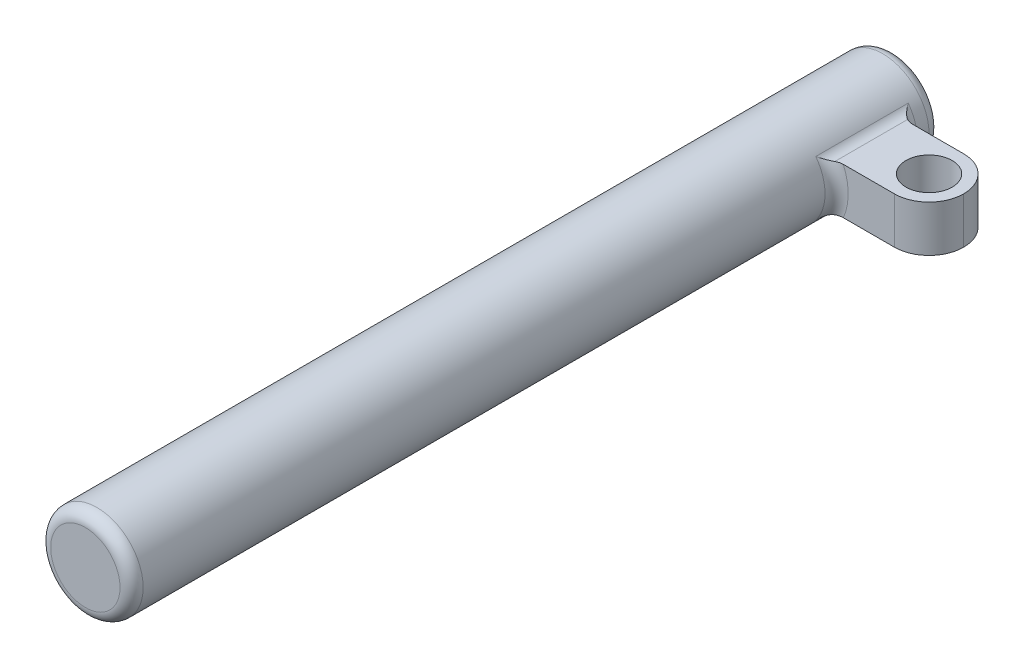
from build123d import *

# Parameters (mm, degrees)
SKETCH1_R           = 10.16
BOSS_EXTRUDE1_DEPTH = 88.9
FILLET1_R           = 2.54
SKETCH3_W           = 15.24
SKETCH3_H           = 10.16
BOSS_EXTRUDE2_DEPTH = 30.48
FILLET2_R           = 7.62
CUT_EXTRUDE1_REACH  = 97.208
SKETCH4_R           = 5.08
FILLET3_R           = 2.54


with BuildPart() as part:
    # Sketch1 → Boss-Extrude1 (new, symmetric)
    with BuildSketch(Plane.XY):
        Circle(SKETCH1_R)
    extrude(amount=BOSS_EXTRUDE1_DEPTH, both=True)

    # Fillet1
    fillet1_edges = [part.edges().sort_by_distance(p)[0] for p in [
        (-10.16, 0, -88.9),
        (-10.16, 0, 88.9),
    ]]
    fillet(fillet1_edges, radius=FILLET1_R)

    # Sketch3 → Boss-Extrude2 (add)
    with BuildSketch(Plane(origin=(0, 0, 0), x_dir=(0, 0, -1), z_dir=(1, 0, 0))):
        with Locations((73.66, 0)):
            Rectangle(SKETCH3_W, SKETCH3_H)
    extrude(amount=BOSS_EXTRUDE2_DEPTH)

    # Fillet2
    fillet2_edges = [part.edges().sort_by_distance(p)[0] for p in [
        (30.48, 0, -81.28),
        (30.48, 0, -66.04),
    ]]
    fillet(fillet2_edges, radius=FILLET2_R - 0.0001)  # a hair under: the kernel refuses the full size

    # Sketch4 → Cut-Extrude1 (cut, up to next)
    with BuildSketch(Plane(origin=(0, 5.08, 0), x_dir=(1, 0, 0), z_dir=(0, 1, 0)), mode=Mode.PRIVATE) as cut_extrude1_sk1:
        with Locations(Location((22.86, 73.66, 0), (0, 0, 270))):
            Circle(SKETCH4_R)
    cut_extrude1_tool1 = extrude(cut_extrude1_sk1.sketch, amount=-CUT_EXTRUDE1_REACH, mode=Mode.PRIVATE) & part.part
    add(cut_extrude1_tool1.solids().sort_by_distance((22.86, 5.08, -73.66))[0], mode=Mode.SUBTRACT)

    # Fillet3
    fillet3_edges = [part.edges().sort_by_distance(p)[0] for p in [
        (8.798818102, -5.08, -73.66),
        (9.813806395, 2.629601498, -66.04),
        (8.798818102, 5.08, -73.66),
        (9.813806395, -2.629601498, -81.28),
    ]]
    fillet(fillet3_edges, radius=FILLET3_R)


solid = part.part
